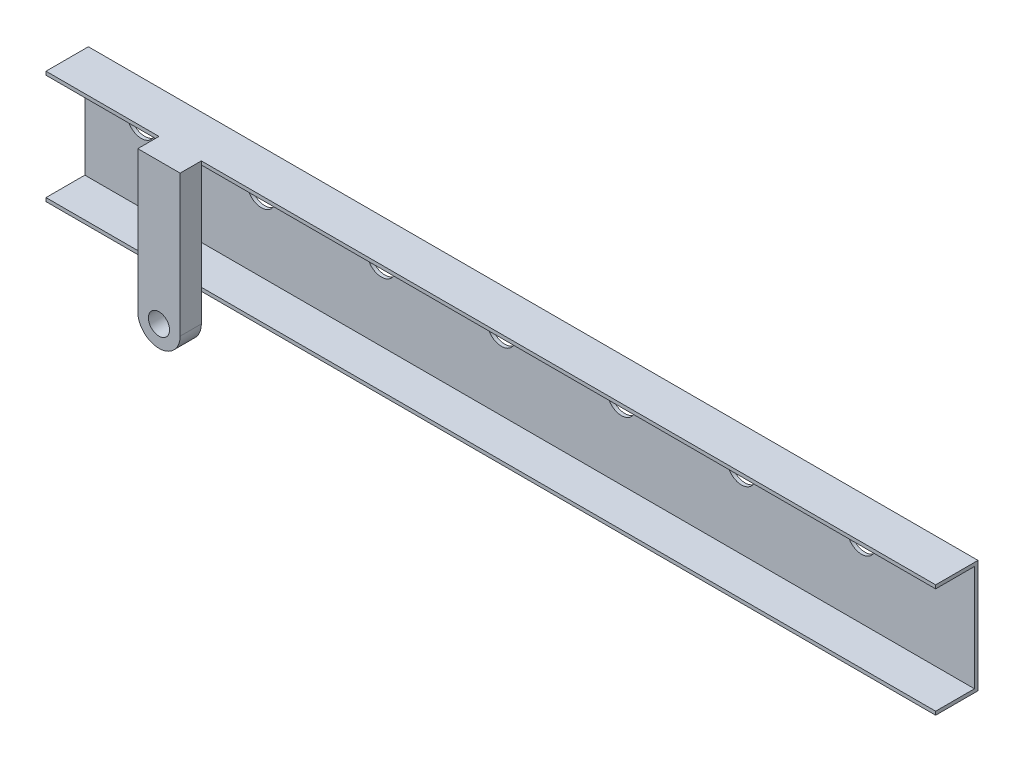
from build123d import *

# Parameters (mm, degrees)
BASE_EXTRUDE_THIN_DEPTH = 800.1
SKETCH2_R               = 12.7
CUT_EXTRUDE1_DEPTH      = 808.424411323
LPATTERN1_COUNT         = 7
LPATTERN1_PITCH         = 107.95
BOSS_EXTRUDE1_START     = 38.1
BOSS_EXTRUDE1_OUTLINE_R = 9.525
BOSS_EXTRUDE1_DEPTH     = 19.05


# Read off the part's stored shape, not the designer's step: Boss-Extrude1
with BuildPart() as part:
    # Sketch1 → Base-Extrude-Thin (new body)
    with BuildSketch(Plane(origin=(0, 0, 0), x_dir=(0, 0, -1), z_dir=(1, 0, 0))):
        Polygon((-38.1, 0), (0, 0), (0, -101.6), (-38.1, -101.6), (-38.1, -98.425), (-3.175, -98.425), (-3.175, -3.175), (-38.1, -3.175), align=None)
    extrude(amount=BASE_EXTRUDE_THIN_DEPTH)

    # Sketch2 → Cut-Extrude1 (cut, through all)
    with BuildSketch(Plane(origin=(0, 0, 0), x_dir=(-1, 0, 0), z_dir=(0, 0, -1))):
        with Locations(Location((-50.8, -31.75, 0), (0, 0, 90))):
            Circle(SKETCH2_R)
    cut_extrude1 = extrude(amount=-CUT_EXTRUDE1_DEPTH, mode=Mode.SUBTRACT)

    # LPattern1: Cut-Extrude1 ×7
    with Locations(*[(i * LPATTERN1_PITCH, 0, 0) for i in range(1, LPATTERN1_COUNT)]):
        add(cut_extrude1, mode=Mode.SUBTRACT)

    # Boss-Extrude1 outline → Boss-Extrude1 (add)
    with BuildSketch(Plane.XY.offset(BOSS_EXTRUDE1_START)):
        with BuildLine():
            Line((101.6, 0), (101.6, -127))
            ThreePointArc((101.6, -127), (120.65, -146.05), (139.7, -127))
            Line((139.7, -127), (139.7, 0))
            Line((139.7, 0), (101.6, 0))
        make_face()
        with Locations((120.65, -127)):
            Circle(BOSS_EXTRUDE1_OUTLINE_R, mode=Mode.SUBTRACT)
    extrude(amount=BOSS_EXTRUDE1_DEPTH)


solid = part.part
